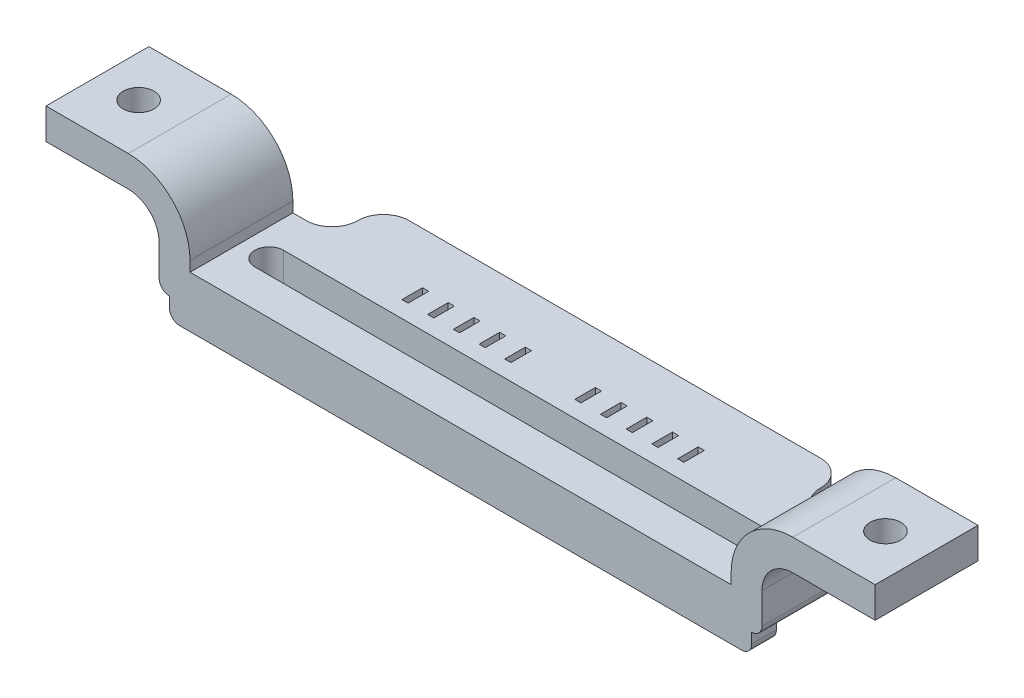
from build123d import *

# Parameters (mm, degrees)
BOSS_EXTRUDE1_DEPTH = 5
CUT_EXTRUDE1_DEPTH  = 42.207887594
CUT_EXTRUDE2_REACH  = 43.822
SKETCH5_R           = 1.5
SKETCH6_W           = 0.6
SKETCH6_H           = 2
CUT_EXTRUDE3_DEPTH  = 0.6
SKETCH8_W           = 56.6
SKETCH8_H           = 2.4
BOSS_EXTRUDE2_DEPTH = 2
SKETCH9_W           = 45
SKETCH9_H           = 5
BOSS_EXTRUDE3_DEPTH = 3
FILLET1_START       = -3
FILLET1_DEPTH       = 10
FILLET1_2_DEPTH     = 3
FILLET2_R           = 1


with BuildPart() as part:
    # Sketch1 → Boss-Extrude1 (new, symmetric)
    with BuildSketch(Plane.XY):
        with BuildLine():
            Line((-26.3, 1), (-26.3, 0))
            Line((-26.3, 0), (26.3, 0))
            Line((26.3, 0), (26.3, 1))
            ThreePointArc((26.3, 1), (28.057359313, 5.242640687), (32.3, 7))
            Line((32.3, 7), (40.3, 7))
            Line((40.3, 7), (40.3, 4))
            Line((40.3, 4), (32.3, 4))
            ThreePointArc((32.3, 4), (30.178679656, 3.121320344), (29.3, 1))
            Line((29.3, 1), (29.3, -2))
            ThreePointArc((29.3, -2), (29.007106781, -2.707106781), (28.3, -3))
            Line((28.3, -3), (-28.3, -3))
            ThreePointArc((-28.3, -3), (-29.007106781, -2.707106781), (-29.3, -2))
            Line((-29.3, -2), (-29.3, 1))
            ThreePointArc((-29.3, 1), (-30.178679656, 3.121320344), (-32.3, 4))
            Line((-32.3, 4), (-40.3, 4))
            Line((-40.3, 4), (-40.3, 7))
            Line((-40.3, 7), (-32.3, 7))
            ThreePointArc((-32.3, 7), (-28.057359313, 5.242640687), (-26.3, 1))
        make_face()
    extrude(amount=BOSS_EXTRUDE1_DEPTH, both=True)

    # Sketch3 → Cut-Extrude1 (cut, through all)
    with BuildSketch(Plane(origin=(0, 0, 0), x_dir=(1, 0, 0), z_dir=(0, 1, 0))):
        with BuildLine():
            Line((-23.6, 1.4), (23.6, 1.4))
            ThreePointArc((23.6, 1.4), (25, 0), (23.6, -1.4))
            Line((23.6, -1.4), (-23.6, -1.4))
            ThreePointArc((-23.6, -1.4), (-25, 0), (-23.6, 1.4))
        make_face()
    extrude(amount=-CUT_EXTRUDE1_DEPTH, mode=Mode.SUBTRACT)

    # Sketch5 → Cut-Extrude2 (cut, up to next)
    with BuildSketch(Plane(origin=(0, 7, 0), x_dir=(1, 0, 0), z_dir=(0, 1, 0)), mode=Mode.PRIVATE) as cut_extrude2_sk1:
        with Locations(Location((-36.3, 0, 0), (0, 0, 180))):
            Circle(SKETCH5_R)
    cut_extrude2_tool1 = extrude(cut_extrude2_sk1.sketch, amount=-CUT_EXTRUDE2_REACH, mode=Mode.PRIVATE) & part.part
    # Sketch5 → Cut-Extrude2 (cut, up to next)
    with BuildSketch(Plane(origin=(0, 7, 0), x_dir=(1, 0, 0), z_dir=(0, 1, 0)), mode=Mode.PRIVATE) as cut_extrude2_sk2:
        with Locations(Location((36.3, 0, 0), (0, 0, 180))):
            Circle(SKETCH5_R)
    cut_extrude2_tool2 = extrude(cut_extrude2_sk2.sketch, amount=-CUT_EXTRUDE2_REACH, mode=Mode.PRIVATE) & part.part
    add(cut_extrude2_tool1.solids().sort_by_distance((-36.3, 7, 0))[0], mode=Mode.SUBTRACT)
    add(cut_extrude2_tool2.solids().sort_by_distance((36.3, 7, 0))[0], mode=Mode.SUBTRACT)

    # Sketch6 → Cut-Extrude3 (cut)
    with BuildSketch(Plane(origin=(0, 0, 0), x_dir=(1, 0, 0), z_dir=(0, 1, 0))):
        with Locations((-5.9, 4)):
            Rectangle(SKETCH6_W, SKETCH6_H)
        with Locations((-3.4, 4)):
            Rectangle(SKETCH6_W, SKETCH6_H)
        with Locations((3.4, 4)):
            Rectangle(SKETCH6_W, SKETCH6_H)
        with Locations((-8.4, 4)):
            Rectangle(SKETCH6_W, SKETCH6_H)
        with Locations((-10.9, 4)):
            Rectangle(SKETCH6_W, SKETCH6_H)
        with Locations((-13.4, 4)):
            Rectangle(SKETCH6_W, SKETCH6_H)
        with Locations((5.9, 4)):
            Rectangle(SKETCH6_W, SKETCH6_H)
        with Locations((8.4, 4)):
            Rectangle(SKETCH6_W, SKETCH6_H)
        with Locations((10.9, 4)):
            Rectangle(SKETCH6_W, SKETCH6_H)
        with Locations((13.4, 4)):
            Rectangle(SKETCH6_W, SKETCH6_H)
    extrude(amount=-CUT_EXTRUDE3_DEPTH, mode=Mode.SUBTRACT)

    # Sketch8 → Boss-Extrude2 (add)
    with BuildSketch(Plane.XZ.offset(3)):
        with Locations((0, 3.8)):
            Rectangle(SKETCH8_W, SKETCH8_H)
    extrude(amount=BOSS_EXTRUDE2_DEPTH)

    # Sketch9 → Boss-Extrude3 (add)
    with BuildSketch(Plane.XZ.offset(3)):
        with Locations((0, -7.5)):
            Rectangle(SKETCH9_W, SKETCH9_H)
    extrude(amount=-BOSS_EXTRUDE3_DEPTH)

    # Fillet1: read off the stored shape, not the designer's step
    # Fillet1 outline → Fillet1 (cut)
    with BuildSketch(Plane(origin=(0, 0, 0), x_dir=(1, 0, 0), z_dir=(0, 1, 0)).offset(FILLET1_START)):
        with BuildLine():
            Line((-22.5, 10), (-22.5, 7.5))
            ThreePointArc((-22.5, 7.5), (-21.767766953, 9.267766953), (-20, 10))
            Line((-20, 10), (-22.5, 10))
        make_face()
        with BuildLine():
            Line((22.5, 10), (20, 10))
            ThreePointArc((20, 10), (21.767766953, 9.267766953), (22.5, 7.5))
            Line((22.5, 7.5), (22.5, 10))
        make_face()
    extrude(amount=FILLET1_DEPTH, mode=Mode.SUBTRACT)

    # Fillet1 2 outline → Fillet1 2 (add)
    with BuildSketch(Plane(origin=(0, 0, 0), x_dir=(1, 0, 0), z_dir=(0, 1, 0)).offset(FILLET1_START)):
        with BuildLine():
            Line((-22.5, 5), (-22.5, 7.5))
            ThreePointArc((-22.5, 7.5), (-23.232233047, 5.732233047), (-25, 5))
            Line((-25, 5), (-22.5, 5))
        make_face()
        with BuildLine():
            ThreePointArc((25, 5), (23.232233047, 5.732233047), (22.5, 7.5))
            Line((22.5, 7.5), (22.5, 5))
            Line((22.5, 5), (25, 5))
        make_face()
    extrude(amount=FILLET1_2_DEPTH)

    # Fillet2
    fillet2_edges = [part.edges().sort_by_distance(p)[0] for p in [
        (-28.3, -5, 3.8),
        (28.3, -5, 3.8),
    ]]
    fillet(fillet2_edges, radius=FILLET2_R)


solid = part.part
